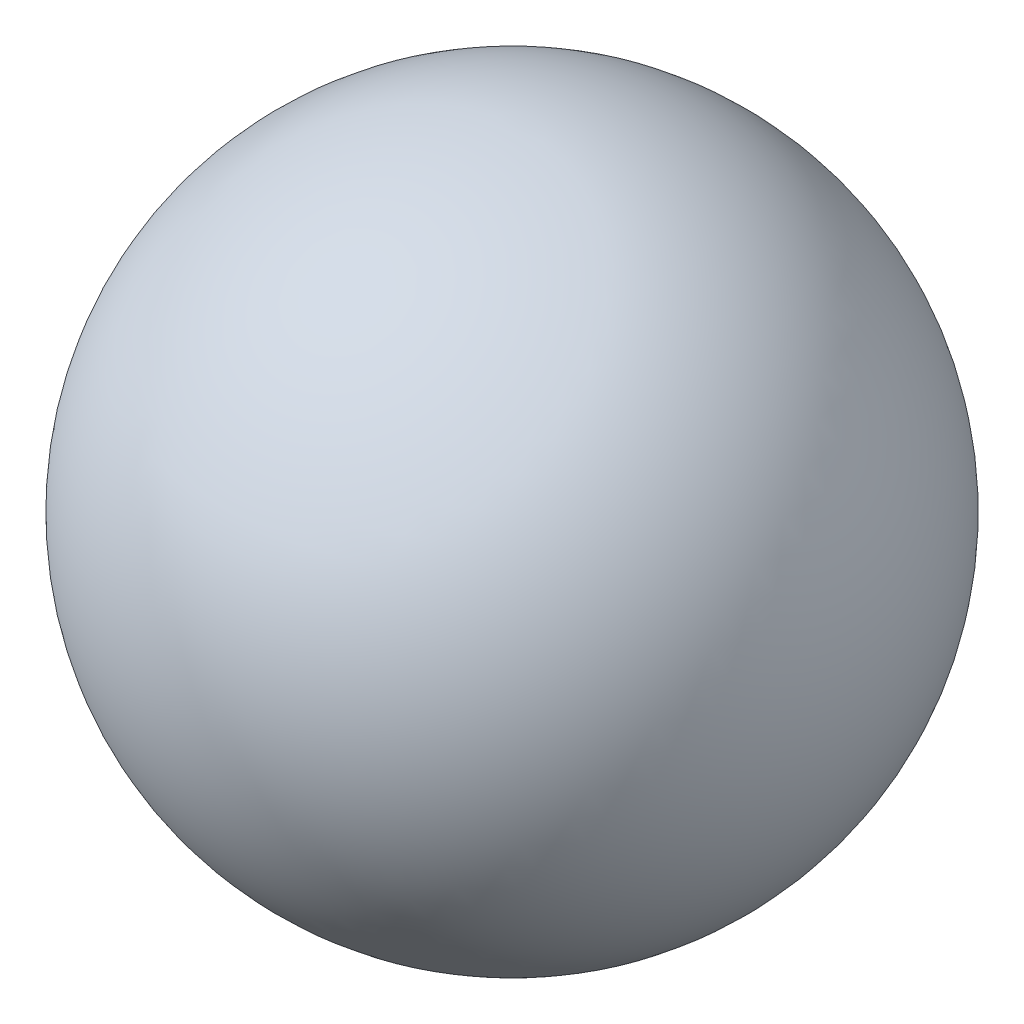
from build123d import *


with BuildPart() as part:
    # 草图1 → 旋转3 (revolve)
    with BuildSketch(Plane.XY):
        with BuildLine():
            Line((0, 15), (0, -15))
            ThreePointArc((0, -15), (15, 0), (0, 15))
        make_face()
    revolve(axis=Axis((0, 17.310975334, 0), (0, -1, 0)))


solid = part.part
